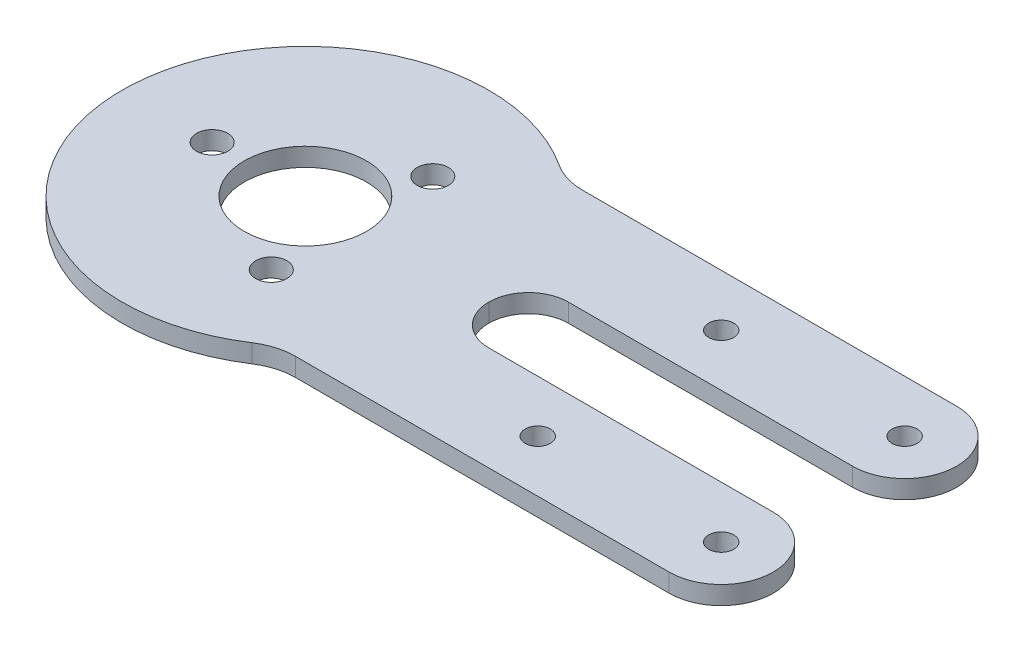
from build123d import *

# Parameters (mm, degrees)
SKETCH1_R           = 30
BOSS_EXTRUDE1_DEPTH = 3
BOSS_EXTRUDE2_START = -3
BOSS_EXTRUDE2_DEPTH = 3
SKETCH3_R           = 2.05
CUT_EXTRUDE1_DEPTH  = 105.446158378
CUT_EXTRUDE3_DEPTH  = 105.446158378
FILLET1_R           = 10
FILLET2_R           = 6.5
SKETCH7_R           = 2.55
CUT_EXTRUDE4_DEPTH  = 97.33924434
CIRPATTERN1_COUNT   = 3
SKETCH8_R           = 10
CUT_EXTRUDE5_DEPTH  = 97.33924434


with BuildPart() as part:
    # Sketch1 → Boss-Extrude1 (new body)
    with BuildSketch(Plane(origin=(0, 0, 0), x_dir=(1, 0, 0), z_dir=(0, 1, 0))):
        with Locations(Location((0, 0, 0), (0, 0, 270))):
            Circle(SKETCH1_R)
    extrude(amount=BOSS_EXTRUDE1_DEPTH)

    # Sketch2 → Boss-Extrude2 (add)
    with BuildSketch(Plane(origin=(0, 3, 0), x_dir=(1, 0, 0), z_dir=(0, 1, 0)).offset(BOSS_EXTRUDE2_START)):
        with BuildLine():
            Line((100, 6.5), (29.287369291, 6.5))
            ThreePointArc((29.287369291, 6.5), (25.430321552, 15.915361943), (18.648056199, 23.5))
            Line((18.648056199, 23.5), (100, 23.5))
            Line((100, 23.5), (100, 6.5))
        make_face()
        with BuildLine():
            Line((29.287369291, -6.5), (100, -6.5))
            Line((100, -6.5), (100, -23.5))
            Line((100, -23.5), (18.648056199, -23.5))
            ThreePointArc((18.648056199, -23.5), (25.430321552, -15.915361943), (29.287369291, -6.5))
        make_face()
    extrude(amount=BOSS_EXTRUDE2_DEPTH)

    # Sketch3 → Cut-Extrude1 (cut, through all)
    with BuildSketch(Plane(origin=(0, 3, 0), x_dir=(1, 0, 0), z_dir=(0, 1, 0))):
        with Locations(Location((53, 15, 0), (0, 0, 270))):
            Circle(SKETCH3_R)
        with Locations(Location((83, 15, 0), (0, 0, 270))):
            Circle(SKETCH3_R)
        with Locations(Location((53, -15, 0), (0, 0, 270))):
            Circle(SKETCH3_R)
        with Locations(Location((83, -15, 0), (0, 0, 270))):
            Circle(SKETCH3_R)
    extrude(amount=-CUT_EXTRUDE1_DEPTH, mode=Mode.SUBTRACT)

    # Sketch6 → Cut-Extrude3 (cut, through all)
    with BuildSketch(Plane(origin=(0, 3, 0), x_dir=(1, 0, 0), z_dir=(0, 1, 0))):
        with BuildLine():
            Line((100, 23.5), (83, 23.5))
            ThreePointArc((83, 23.5), (91.5, 15), (83, 6.5))
            Line((83, 6.5), (100, 6.5))
            Line((100, 6.5), (100, 23.5))
        make_face()
        with BuildLine():
            Line((100, -6.5), (83, -6.5))
            ThreePointArc((83, -6.5), (91.5, -15), (83, -23.5))
            Line((83, -23.5), (100, -23.5))
            Line((100, -23.5), (100, -6.5))
        make_face()
    extrude(amount=-CUT_EXTRUDE3_DEPTH, mode=Mode.SUBTRACT)

    # Fillet1
    fillet1_edges = [part.edges().sort_by_distance(p)[0] for p in [
        (18.648056199, 1.5, 23.5),
        (18.648056199, 1.5, -23.5),
    ]]
    fillet(fillet1_edges, radius=FILLET1_R)

    # Fillet2
    fillet2_edges = [part.edges().sort_by_distance(p)[0] for p in [
        (29.287369291, 1.5, 6.5),
        (29.287369291, 1.5, -6.5),
    ]]
    fillet(fillet2_edges, radius=FILLET2_R - 0.0001)  # a hair under: the kernel refuses the full size

    # Sketch7 → Cut-Extrude4 (cut, through all)
    with BuildSketch(Plane(origin=(0, 3, 0), x_dir=(1, 0, 0), z_dir=(0, 1, 0))):
        with Locations(Location((-15.25, 0, 0), (0, 0, 270))):
            Circle(SKETCH7_R)
    cut_extrude4 = extrude(amount=-CUT_EXTRUDE4_DEPTH, mode=Mode.SUBTRACT)

    # CirPattern1: Cut-Extrude4 ×3 about axis
    cirpattern1_axis = Axis((0, 0, 0), (0, 1, 0))
    for i in range(1, CIRPATTERN1_COUNT):
        add(cut_extrude4.rotate(cirpattern1_axis, i * 360 / CIRPATTERN1_COUNT), mode=Mode.SUBTRACT)

    # Sketch8 → Cut-Extrude5 (cut, through all)
    with BuildSketch(Plane(origin=(0, 3, 0), x_dir=(1, 0, 0), z_dir=(0, 1, 0))):
        with Locations(Location((0, 0, 0), (0, 0, 270))):
            Circle(SKETCH8_R)
    extrude(amount=-CUT_EXTRUDE5_DEPTH, mode=Mode.SUBTRACT)


solid = part.part
